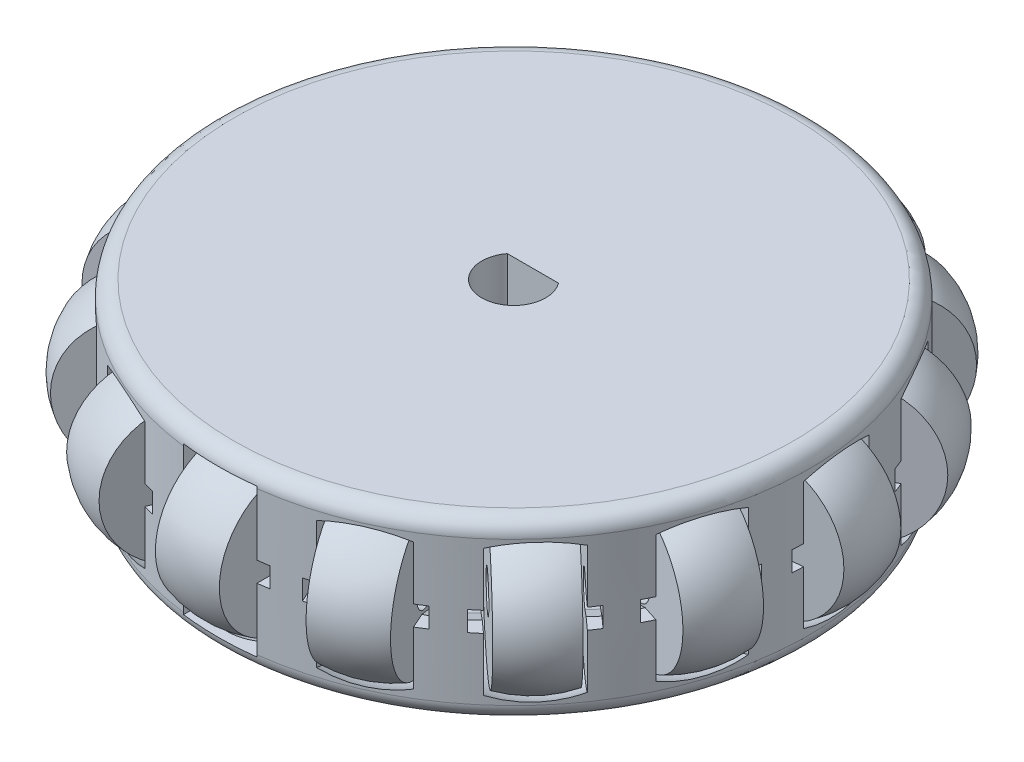
from build123d import *

# Parameters (mm, degrees)
SKETCH1_R                 = 18.5
BOSS_EXTRUDE1_DEPTH       = 5.5
CUT_EXTRUDE3_START        = -0.7
CUT_EXTRUDE3_DEPTH        = 0.7
SKETCH5_3_W               = 16.000371142
SKETCH5_3_H               = 9.25640646
CUT_EXTRUDE4_DEPTH        = 4.6
CIRPATTERN6_COUNT         = 15
CIRPATTERN6_START         = -0.7
CIRPATTERN6_COPY_1_DEPTH  = 0.7
CIRPATTERN6_COPY_2_DEPTH  = 0.7
CIRPATTERN6_COPY_3_DEPTH  = 0.7
CIRPATTERN6_COPY_4_DEPTH  = 0.7
CIRPATTERN6_COPY_5_DEPTH  = 0.7
CIRPATTERN6_COPY_6_DEPTH  = 0.7
CIRPATTERN6_COPY_7_DEPTH  = 0.7
CIRPATTERN6_COPY_8_DEPTH  = 0.7
CIRPATTERN6_COPY_9_DEPTH  = 0.7
CIRPATTERN6_COPY_10_DEPTH = 0.7
CIRPATTERN6_COPY_11_DEPTH = 0.7
CIRPATTERN6_COPY_12_DEPTH = 0.7
CIRPATTERN6_COPY_13_DEPTH = 0.7
CIRPATTERN6_COPY_14_DEPTH = 0.7
CIRPATTERN7_COUNT         = 15
FILLET1_R                 = 1


with BuildPart() as part:
    # Sketch1 → Boss-Extrude1 (new, symmetric)
    with BuildSketch(Plane(origin=(0, 0, 0), x_dir=(1, 0, 0), z_dir=(0, 1, 0))):
        with Locations(Location((0, 0, 0), (0, 0, 270))):
            Circle(SKETCH1_R)
        with BuildLine():
            Line((-1.6, 1.2), (1.6, 1.2))
            ThreePointArc((1.6, 1.2), (0, -2), (-1.6, 1.2))
        make_face(mode=Mode.SUBTRACT)
    extrude(amount=BOSS_EXTRUDE1_DEPTH, both=True)

    # Sketch4 → Cut-Revolve1 (revolve, cut)
    with BuildSketch(Plane.XY.offset(16), mode=Mode.PRIVATE) as cut_revolve1_sk:
        with BuildLine():
            Line((2.3, 1), (2.3, 4.62820323))
            ThreePointArc((2.3, 4.62820323), (0, 5), (-2.3, 4.62820323))
            Line((-2.3, 4.62820323), (-2.3, 1))
            Line((-2.3, 1), (-3, 1))
            Line((-3, 1), (-3, 0))
            Line((-3, 0), (3, 0))
            Line((3, 0), (3, 1))
            Line((3, 1), (2.3, 1))
        make_face()
        with BuildLine():
            ThreePointArc((2, 4.408203932), (0, 4.7), (-2, 4.408203932))
            Line((-2, 4.408203932), (-2, 1.15))
            Line((-2, 1.15), (2, 1.15))
            Line((2, 1.15), (2, 4.408203932))
        make_face(mode=Mode.SUBTRACT)
        with BuildLine():
            Line((2, 1.15), (2, 4.408203932))
            ThreePointArc((2, 4.408203932), (0, 4.7), (-2, 4.408203932))
            Line((-2, 4.408203932), (-2, 1.15))
            Line((-2, 1.15), (2, 1.15))
        make_face()
    cut_revolve1 = revolve(cut_revolve1_sk.sketch.rotate(Axis((-6.345477643, 0, 16), (1, 0, 0)), 90), axis=Axis((-6.345477643, 0, 16), (1, 0, 0)), mode=Mode.SUBTRACT)

    # Sketch5 → Cut-Extrude3 (cut)
    with BuildSketch(Plane(origin=(-2.3, 0, 0), x_dir=(0, 0, -1), z_dir=(1, 0, 0)).offset(CUT_EXTRUDE3_START)):
        with BuildLine():
            Line((-17, 0), (-18.356470249, 0))
            Line((-18.356470249, 0), (-18.356470249, -0.625))
            Line((-18.356470249, -0.625), (-17.309780839, -0.625))
            Line((-17.309780839, -0.625), (-16.309780839, -0.950807989))
            ThreePointArc((-16.309780839, -0.950807989), (-16.809253001, -0.58746028), (-17, 0))
        make_face()
        with BuildLine():
            ThreePointArc((-17, 0), (-16.809253001, 0.58746028), (-16.309780839, 0.950807989))
            Line((-16.309780839, 0.950807989), (-17.309780839, 0.625))
            Line((-17.309780839, 0.625), (-18.356470249, 0.625))
            Line((-18.356470249, 0.625), (-18.356470249, 0))
            Line((-18.356470249, 0), (-17, 0))
        make_face()
    cut_extrude3 = extrude(amount=CUT_EXTRUDE3_DEPTH, mode=Mode.SUBTRACT)

    # Mirror1: Cut-Extrude3 across plane
    add(cut_extrude3.mirror(Plane(origin=(0, 0, 0), x_dir=(0, 0, 1), z_dir=(1, 0, 0))), mode=Mode.SUBTRACT)

    # Sketch5<3> → Cut-Extrude4 (cut)
    with BuildSketch(Plane(origin=(-2.3, 0, 0), x_dir=(0, 0, -1), z_dir=(1, 0, 0))):
        with Locations((-24.000185571, 0)):
            Rectangle(SKETCH5_3_W, SKETCH5_3_H)
    extrude(amount=CUT_EXTRUDE4_DEPTH, mode=Mode.SUBTRACT)

    # CirPattern6: Cut-Revolve1, Cut-Extrude3 ×15 about axis
    cirpattern6_axis = Axis((0, 0, 0), (0, 1, 0))
    add([cut_revolve1.rotate(cirpattern6_axis, i * 360 / CIRPATTERN6_COUNT) for i in range(1, CIRPATTERN6_COUNT)], mode=Mode.SUBTRACT)
    add([cut_extrude3.rotate(cirpattern6_axis, i * 360 / CIRPATTERN6_COUNT) for i in range(1, CIRPATTERN6_COUNT)], mode=Mode.SUBTRACT)

    # CirPattern6 copy 1 sketch → CirPattern6 copy 1 (cut)
    with BuildSketch(Plane(origin=(2.101154553, 0, -0.935494279), x_dir=(-0.4067366430758002, 0, -0.9135454576426009), z_dir=(-0.9135454576426009, 0, 0.4067366430758002)).offset(CIRPATTERN6_START)):
        with BuildLine():
            Line((-17, 0), (-18.356470249, 0))
            Line((-18.356470249, 0), (-18.356470249, 0.625))
            Line((-18.356470249, 0.625), (-17.309780839, 0.625))
            Line((-17.309780839, 0.625), (-16.309780839, 0.950807989))
            ThreePointArc((-16.309780839, 0.950807989), (-16.809253001, 0.58746028), (-17, 0))
        make_face()
        with BuildLine():
            ThreePointArc((-17, 0), (-16.809253001, -0.58746028), (-16.309780839, -0.950807989))
            Line((-16.309780839, -0.950807989), (-17.309780839, -0.625))
            Line((-17.309780839, -0.625), (-18.356470249, -0.625))
            Line((-18.356470249, -0.625), (-18.356470249, 0))
            Line((-18.356470249, 0), (-17, 0))
        make_face()
    extrude(amount=CIRPATTERN6_COPY_1_DEPTH, mode=Mode.SUBTRACT)

    # CirPattern6 copy 2 sketch → CirPattern6 copy 2 (cut)
    with BuildSketch(Plane(origin=(1.539000395, 0, -1.709233099), x_dir=(-0.7431448254773942, 0, -0.6691306063588582), z_dir=(-0.6691306063588582, 0, 0.7431448254773942)).offset(CIRPATTERN6_START)):
        with BuildLine():
            Line((-17, 0), (-18.356470249, 0))
            Line((-18.356470249, 0), (-18.356470249, 0.625))
            Line((-18.356470249, 0.625), (-17.309780839, 0.625))
            Line((-17.309780839, 0.625), (-16.309780839, 0.950807989))
            ThreePointArc((-16.309780839, 0.950807989), (-16.809253001, 0.58746028), (-17, 0))
        make_face()
        with BuildLine():
            ThreePointArc((-17, 0), (-16.809253001, -0.58746028), (-16.309780839, -0.950807989))
            Line((-16.309780839, -0.950807989), (-17.309780839, -0.625))
            Line((-17.309780839, -0.625), (-18.356470249, -0.625))
            Line((-18.356470249, -0.625), (-18.356470249, 0))
            Line((-18.356470249, 0), (-17, 0))
        make_face()
    extrude(amount=CIRPATTERN6_COPY_2_DEPTH, mode=Mode.SUBTRACT)

    # CirPattern6 copy 3 sketch → CirPattern6 copy 3 (cut)
    with BuildSketch(Plane(origin=(0.710739087, 0, -2.187429987), x_dir=(-0.9510565162951535, 0, -0.30901699437494745), z_dir=(-0.30901699437494745, 0, 0.9510565162951535)).offset(CIRPATTERN6_START)):
        with BuildLine():
            Line((-17, 0), (-18.356470249, 0))
            Line((-18.356470249, 0), (-18.356470249, 0.625))
            Line((-18.356470249, 0.625), (-17.309780839, 0.625))
            Line((-17.309780839, 0.625), (-16.309780839, 0.950807989))
            ThreePointArc((-16.309780839, 0.950807989), (-16.809253001, 0.58746028), (-17, 0))
        make_face()
        with BuildLine():
            ThreePointArc((-17, 0), (-16.809253001, -0.58746028), (-16.309780839, -0.950807989))
            Line((-16.309780839, -0.950807989), (-17.309780839, -0.625))
            Line((-17.309780839, -0.625), (-18.356470249, -0.625))
            Line((-18.356470249, -0.625), (-18.356470249, 0))
            Line((-18.356470249, 0), (-17, 0))
        make_face()
    extrude(amount=CIRPATTERN6_COPY_3_DEPTH, mode=Mode.SUBTRACT)

    # CirPattern6 copy 4 sketch → CirPattern6 copy 4 (cut)
    with BuildSketch(Plane(origin=(-0.240415466, 0, -2.287400359), x_dir=(-0.9945218953682733, 0, 0.10452846326765355), z_dir=(0.10452846326765355, 0, 0.9945218953682733)).offset(CIRPATTERN6_START)):
        with BuildLine():
            Line((-17, 0), (-18.356470249, 0))
            Line((-18.356470249, 0), (-18.356470249, 0.625))
            Line((-18.356470249, 0.625), (-17.309780839, 0.625))
            Line((-17.309780839, 0.625), (-16.309780839, 0.950807989))
            ThreePointArc((-16.309780839, 0.950807989), (-16.809253001, 0.58746028), (-17, 0))
        make_face()
        with BuildLine():
            ThreePointArc((-17, 0), (-16.809253001, -0.58746028), (-16.309780839, -0.950807989))
            Line((-16.309780839, -0.950807989), (-17.309780839, -0.625))
            Line((-17.309780839, -0.625), (-18.356470249, -0.625))
            Line((-18.356470249, -0.625), (-18.356470249, 0))
            Line((-18.356470249, 0), (-17, 0))
        make_face()
    extrude(amount=CIRPATTERN6_COPY_4_DEPTH, mode=Mode.SUBTRACT)

    # CirPattern6 copy 5 sketch → CirPattern6 copy 5 (cut)
    with BuildSketch(Plane(origin=(-1.15, 0, -1.991858429), x_dir=(-0.8660254037844387, 0, 0.4999999999999998), z_dir=(0.4999999999999998, 0, 0.8660254037844387)).offset(CIRPATTERN6_START)):
        with BuildLine():
            Line((-17, 0), (-18.356470249, 0))
            Line((-18.356470249, 0), (-18.356470249, 0.625))
            Line((-18.356470249, 0.625), (-17.309780839, 0.625))
            Line((-17.309780839, 0.625), (-16.309780839, 0.950807989))
            ThreePointArc((-16.309780839, 0.950807989), (-16.809253001, 0.58746028), (-17, 0))
        make_face()
        with BuildLine():
            ThreePointArc((-17, 0), (-16.809253001, -0.58746028), (-16.309780839, -0.950807989))
            Line((-16.309780839, -0.950807989), (-17.309780839, -0.625))
            Line((-17.309780839, -0.625), (-18.356470249, -0.625))
            Line((-18.356470249, -0.625), (-18.356470249, 0))
            Line((-18.356470249, 0), (-17, 0))
        make_face()
    extrude(amount=CIRPATTERN6_COPY_5_DEPTH, mode=Mode.SUBTRACT)

    # CirPattern6 copy 6 sketch → CirPattern6 copy 6 (cut)
    with BuildSketch(Plane(origin=(-1.860739087, 0, -1.35190608), x_dir=(-0.5877852522924732, 0, 0.8090169943749473), z_dir=(0.8090169943749473, 0, 0.5877852522924732)).offset(CIRPATTERN6_START)):
        with BuildLine():
            Line((-17, 0), (-18.356470249, 0))
            Line((-18.356470249, 0), (-18.356470249, 0.625))
            Line((-18.356470249, 0.625), (-17.309780839, 0.625))
            Line((-17.309780839, 0.625), (-16.309780839, 0.950807989))
            ThreePointArc((-16.309780839, 0.950807989), (-16.809253001, 0.58746028), (-17, 0))
        make_face()
        with BuildLine():
            ThreePointArc((-17, 0), (-16.809253001, -0.58746028), (-16.309780839, -0.950807989))
            Line((-16.309780839, -0.950807989), (-17.309780839, -0.625))
            Line((-17.309780839, -0.625), (-18.356470249, -0.625))
            Line((-18.356470249, -0.625), (-18.356470249, 0))
            Line((-18.356470249, 0), (-17, 0))
        make_face()
    extrude(amount=CIRPATTERN6_COPY_6_DEPTH, mode=Mode.SUBTRACT)

    # CirPattern6 copy 7 sketch → CirPattern6 copy 7 (cut)
    with BuildSketch(Plane(origin=(-2.249739482, 0, -0.478196889), x_dir=(-0.20791169081775931, 0, 0.9781476007338057), z_dir=(0.9781476007338057, 0, 0.20791169081775931)).offset(CIRPATTERN6_START)):
        with BuildLine():
            Line((-17, 0), (-18.356470249, 0))
            Line((-18.356470249, 0), (-18.356470249, 0.625))
            Line((-18.356470249, 0.625), (-17.309780839, 0.625))
            Line((-17.309780839, 0.625), (-16.309780839, 0.950807989))
            ThreePointArc((-16.309780839, 0.950807989), (-16.809253001, 0.58746028), (-17, 0))
        make_face()
        with BuildLine():
            ThreePointArc((-17, 0), (-16.809253001, -0.58746028), (-16.309780839, -0.950807989))
            Line((-16.309780839, -0.950807989), (-17.309780839, -0.625))
            Line((-17.309780839, -0.625), (-18.356470249, -0.625))
            Line((-18.356470249, -0.625), (-18.356470249, 0))
            Line((-18.356470249, 0), (-17, 0))
        make_face()
    extrude(amount=CIRPATTERN6_COPY_7_DEPTH, mode=Mode.SUBTRACT)

    # CirPattern6 copy 8 sketch → CirPattern6 copy 8 (cut)
    with BuildSketch(Plane(origin=(-2.249739482, 0, 0.478196889), x_dir=(0.2079116908177595, 0, 0.9781476007338056), z_dir=(0.9781476007338056, 0, -0.2079116908177595)).offset(CIRPATTERN6_START)):
        with BuildLine():
            Line((-17, 0), (-18.356470249, 0))
            Line((-18.356470249, 0), (-18.356470249, 0.625))
            Line((-18.356470249, 0.625), (-17.309780839, 0.625))
            Line((-17.309780839, 0.625), (-16.309780839, 0.950807989))
            ThreePointArc((-16.309780839, 0.950807989), (-16.809253001, 0.58746028), (-17, 0))
        make_face()
        with BuildLine():
            ThreePointArc((-17, 0), (-16.809253001, -0.58746028), (-16.309780839, -0.950807989))
            Line((-16.309780839, -0.950807989), (-17.309780839, -0.625))
            Line((-17.309780839, -0.625), (-18.356470249, -0.625))
            Line((-18.356470249, -0.625), (-18.356470249, 0))
            Line((-18.356470249, 0), (-17, 0))
        make_face()
    extrude(amount=CIRPATTERN6_COPY_8_DEPTH, mode=Mode.SUBTRACT)

    # CirPattern6 copy 9 sketch → CirPattern6 copy 9 (cut)
    with BuildSketch(Plane(origin=(-1.860739087, 0, 1.35190608), x_dir=(0.587785252292473, 0, 0.8090169943749476), z_dir=(0.8090169943749476, 0, -0.587785252292473)).offset(CIRPATTERN6_START)):
        with BuildLine():
            Line((-17, 0), (-18.356470249, 0))
            Line((-18.356470249, 0), (-18.356470249, 0.625))
            Line((-18.356470249, 0.625), (-17.309780839, 0.625))
            Line((-17.309780839, 0.625), (-16.309780839, 0.950807989))
            ThreePointArc((-16.309780839, 0.950807989), (-16.809253001, 0.58746028), (-17, 0))
        make_face()
        with BuildLine():
            ThreePointArc((-17, 0), (-16.809253001, -0.58746028), (-16.309780839, -0.950807989))
            Line((-16.309780839, -0.950807989), (-17.309780839, -0.625))
            Line((-17.309780839, -0.625), (-18.356470249, -0.625))
            Line((-18.356470249, -0.625), (-18.356470249, 0))
            Line((-18.356470249, 0), (-17, 0))
        make_face()
    extrude(amount=CIRPATTERN6_COPY_9_DEPTH, mode=Mode.SUBTRACT)

    # CirPattern6 copy 10 sketch → CirPattern6 copy 10 (cut)
    with BuildSketch(Plane(origin=(-1.15, 0, 1.991858429), x_dir=(0.8660254037844384, 0, 0.5000000000000004), z_dir=(0.5000000000000004, 0, -0.8660254037844384)).offset(CIRPATTERN6_START)):
        with BuildLine():
            Line((-17, 0), (-18.356470249, 0))
            Line((-18.356470249, 0), (-18.356470249, 0.625))
            Line((-18.356470249, 0.625), (-17.309780839, 0.625))
            Line((-17.309780839, 0.625), (-16.309780839, 0.950807989))
            ThreePointArc((-16.309780839, 0.950807989), (-16.809253001, 0.58746028), (-17, 0))
        make_face()
        with BuildLine():
            ThreePointArc((-17, 0), (-16.809253001, -0.58746028), (-16.309780839, -0.950807989))
            Line((-16.309780839, -0.950807989), (-17.309780839, -0.625))
            Line((-17.309780839, -0.625), (-18.356470249, -0.625))
            Line((-18.356470249, -0.625), (-18.356470249, 0))
            Line((-18.356470249, 0), (-17, 0))
        make_face()
    extrude(amount=CIRPATTERN6_COPY_10_DEPTH, mode=Mode.SUBTRACT)

    # CirPattern6 copy 11 sketch → CirPattern6 copy 11 (cut)
    with BuildSketch(Plane(origin=(-0.240415466, 0, 2.287400359), x_dir=(0.9945218953682734, 0, 0.10452846326765336), z_dir=(0.10452846326765336, 0, -0.9945218953682734)).offset(CIRPATTERN6_START)):
        with BuildLine():
            Line((-17, 0), (-18.356470249, 0))
            Line((-18.356470249, 0), (-18.356470249, 0.625))
            Line((-18.356470249, 0.625), (-17.309780839, 0.625))
            Line((-17.309780839, 0.625), (-16.309780839, 0.950807989))
            ThreePointArc((-16.309780839, 0.950807989), (-16.809253001, 0.58746028), (-17, 0))
        make_face()
        with BuildLine():
            ThreePointArc((-17, 0), (-16.809253001, -0.58746028), (-16.309780839, -0.950807989))
            Line((-16.309780839, -0.950807989), (-17.309780839, -0.625))
            Line((-17.309780839, -0.625), (-18.356470249, -0.625))
            Line((-18.356470249, -0.625), (-18.356470249, 0))
            Line((-18.356470249, 0), (-17, 0))
        make_face()
    extrude(amount=CIRPATTERN6_COPY_11_DEPTH, mode=Mode.SUBTRACT)

    # CirPattern6 copy 12 sketch → CirPattern6 copy 12 (cut)
    with BuildSketch(Plane(origin=(0.710739087, 0, 2.187429987), x_dir=(0.9510565162951536, 0, -0.30901699437494723), z_dir=(-0.30901699437494723, 0, -0.9510565162951536)).offset(CIRPATTERN6_START)):
        with BuildLine():
            Line((-17, 0), (-18.356470249, 0))
            Line((-18.356470249, 0), (-18.356470249, 0.625))
            Line((-18.356470249, 0.625), (-17.309780839, 0.625))
            Line((-17.309780839, 0.625), (-16.309780839, 0.950807989))
            ThreePointArc((-16.309780839, 0.950807989), (-16.809253001, 0.58746028), (-17, 0))
        make_face()
        with BuildLine():
            ThreePointArc((-17, 0), (-16.809253001, -0.58746028), (-16.309780839, -0.950807989))
            Line((-16.309780839, -0.950807989), (-17.309780839, -0.625))
            Line((-17.309780839, -0.625), (-18.356470249, -0.625))
            Line((-18.356470249, -0.625), (-18.356470249, 0))
            Line((-18.356470249, 0), (-17, 0))
        make_face()
    extrude(amount=CIRPATTERN6_COPY_12_DEPTH, mode=Mode.SUBTRACT)

    # CirPattern6 copy 13 sketch → CirPattern6 copy 13 (cut)
    with BuildSketch(Plane(origin=(1.539000395, 0, 1.709233099), x_dir=(0.7431448254773946, 0, -0.6691306063588578), z_dir=(-0.6691306063588578, 0, -0.7431448254773946)).offset(CIRPATTERN6_START)):
        with BuildLine():
            Line((-17, 0), (-18.356470249, 0))
            Line((-18.356470249, 0), (-18.356470249, 0.625))
            Line((-18.356470249, 0.625), (-17.309780839, 0.625))
            Line((-17.309780839, 0.625), (-16.309780839, 0.950807989))
            ThreePointArc((-16.309780839, 0.950807989), (-16.809253001, 0.58746028), (-17, 0))
        make_face()
        with BuildLine():
            ThreePointArc((-17, 0), (-16.809253001, -0.58746028), (-16.309780839, -0.950807989))
            Line((-16.309780839, -0.950807989), (-17.309780839, -0.625))
            Line((-17.309780839, -0.625), (-18.356470249, -0.625))
            Line((-18.356470249, -0.625), (-18.356470249, 0))
            Line((-18.356470249, 0), (-17, 0))
        make_face()
    extrude(amount=CIRPATTERN6_COPY_13_DEPTH, mode=Mode.SUBTRACT)

    # CirPattern6 copy 14 sketch → CirPattern6 copy 14 (cut)
    with BuildSketch(Plane(origin=(2.101154553, 0, 0.935494279), x_dir=(0.40673664307580015, 0, -0.913545457642601), z_dir=(-0.913545457642601, 0, -0.40673664307580015)).offset(CIRPATTERN6_START)):
        with BuildLine():
            Line((-17, 0), (-18.356470249, 0))
            Line((-18.356470249, 0), (-18.356470249, 0.625))
            Line((-18.356470249, 0.625), (-17.309780839, 0.625))
            Line((-17.309780839, 0.625), (-16.309780839, 0.950807989))
            ThreePointArc((-16.309780839, 0.950807989), (-16.809253001, 0.58746028), (-17, 0))
        make_face()
        with BuildLine():
            ThreePointArc((-17, 0), (-16.809253001, -0.58746028), (-16.309780839, -0.950807989))
            Line((-16.309780839, -0.950807989), (-17.309780839, -0.625))
            Line((-17.309780839, -0.625), (-18.356470249, -0.625))
            Line((-18.356470249, -0.625), (-18.356470249, 0))
            Line((-18.356470249, 0), (-17, 0))
        make_face()
    extrude(amount=CIRPATTERN6_COPY_14_DEPTH, mode=Mode.SUBTRACT)

    # Fillet1
    # the kernel refuses this fillet: 1 mm, written as the material it takes off along each edge
    with BuildSketch(Plane(origin=(0, 5.5, 0), x_dir=(0, 0, 1), z_dir=(-1, 0, 0))) as fillet1_piece_1:
        with BuildLine():
            CenterArc((18.5 - FILLET1_R, -FILLET1_R), FILLET1_R, 0, 90)
            Line((18.5 - FILLET1_R, 0), (18.5, 0))
            Line((18.5, 0), (18.5, -FILLET1_R))
        make_face()
    revolve(axis=Axis((0, 5.5, 0), (0, 1, 0)), mode=Mode.SUBTRACT)
    with BuildSketch(Plane(origin=(0, -5.5, 0), x_dir=(0, 0, 1), z_dir=(-1, 0, 0))) as fillet1_piece_2:
        with BuildLine():
            CenterArc((18.5 - FILLET1_R, FILLET1_R), FILLET1_R, 270, 90)
            Line((18.5 - FILLET1_R, 0), (18.5, 0))
            Line((18.5, 0), (18.5, FILLET1_R))
        make_face()
    revolve(axis=Axis((0, -5.5, 0), (0, 1, 0)), mode=Mode.SUBTRACT)


with BuildPart() as body_2:
    # Sketch4<3> → Revolve1 (revolve)
    with BuildSketch(Plane.XY.offset(16), mode=Mode.PRIVATE) as revolve1_sk:
        with BuildLine():
            Line((2, 1.15), (2, 4.408203932))
            ThreePointArc((2, 4.408203932), (0, 4.7), (-2, 4.408203932))
            Line((-2, 4.408203932), (-2, 1.15))
            Line((-2, 1.15), (2, 1.15))
        make_face()
    revolve(revolve1_sk.sketch.rotate(Axis((-6.345477643, 0, 16), (1, 0, 0)), 90), axis=Axis((-6.345477643, 0, 16), (1, 0, 0)))


with BuildPart() as cirpattern7_1:
    # CirPattern7: pattern copy
    add(body_2.part.rotate(Axis((0, 0, 0), (0, 1, 0)), 1 * 360 / CIRPATTERN7_COUNT))


with BuildPart() as cirpattern7_2:
    # CirPattern7: pattern copy
    add(body_2.part.rotate(Axis((0, 0, 0), (0, 1, 0)), 2 * 360 / CIRPATTERN7_COUNT))


with BuildPart() as cirpattern7_3:
    # CirPattern7: pattern copy
    add(body_2.part.rotate(Axis((0, 0, 0), (0, 1, 0)), 3 * 360 / CIRPATTERN7_COUNT))


with BuildPart() as cirpattern7_4:
    # CirPattern7: pattern copy
    add(body_2.part.rotate(Axis((0, 0, 0), (0, 1, 0)), 4 * 360 / CIRPATTERN7_COUNT))


with BuildPart() as cirpattern7_5:
    # CirPattern7: pattern copy
    add(body_2.part.rotate(Axis((0, 0, 0), (0, 1, 0)), 5 * 360 / CIRPATTERN7_COUNT))


with BuildPart() as cirpattern7_6:
    # CirPattern7: pattern copy
    add(body_2.part.rotate(Axis((0, 0, 0), (0, 1, 0)), 6 * 360 / CIRPATTERN7_COUNT))


with BuildPart() as cirpattern7_7:
    # CirPattern7: pattern copy
    add(body_2.part.rotate(Axis((0, 0, 0), (0, 1, 0)), 7 * 360 / CIRPATTERN7_COUNT))


with BuildPart() as cirpattern7_8:
    # CirPattern7: pattern copy
    add(body_2.part.rotate(Axis((0, 0, 0), (0, 1, 0)), 8 * 360 / CIRPATTERN7_COUNT))


with BuildPart() as cirpattern7_9:
    # CirPattern7: pattern copy
    add(body_2.part.rotate(Axis((0, 0, 0), (0, 1, 0)), 9 * 360 / CIRPATTERN7_COUNT))


with BuildPart() as cirpattern7_10:
    # CirPattern7: pattern copy
    add(body_2.part.rotate(Axis((0, 0, 0), (0, 1, 0)), 10 * 360 / CIRPATTERN7_COUNT))


with BuildPart() as cirpattern7_11:
    # CirPattern7: pattern copy
    add(body_2.part.rotate(Axis((0, 0, 0), (0, 1, 0)), 11 * 360 / CIRPATTERN7_COUNT))


with BuildPart() as cirpattern7_12:
    # CirPattern7: pattern copy
    add(body_2.part.rotate(Axis((0, 0, 0), (0, 1, 0)), 12 * 360 / CIRPATTERN7_COUNT))


with BuildPart() as cirpattern7_13:
    # CirPattern7: pattern copy
    add(body_2.part.rotate(Axis((0, 0, 0), (0, 1, 0)), 13 * 360 / CIRPATTERN7_COUNT))


with BuildPart() as cirpattern7_14:
    # CirPattern7: pattern copy
    add(body_2.part.rotate(Axis((0, 0, 0), (0, 1, 0)), 14 * 360 / CIRPATTERN7_COUNT))


solid = Compound([part.part, body_2.part, cirpattern7_1.part, cirpattern7_2.part, cirpattern7_3.part, cirpattern7_4.part, cirpattern7_5.part, cirpattern7_6.part, cirpattern7_7.part, cirpattern7_8.part, cirpattern7_9.part, cirpattern7_10.part, cirpattern7_11.part, cirpattern7_12.part, cirpattern7_13.part, cirpattern7_14.part])
